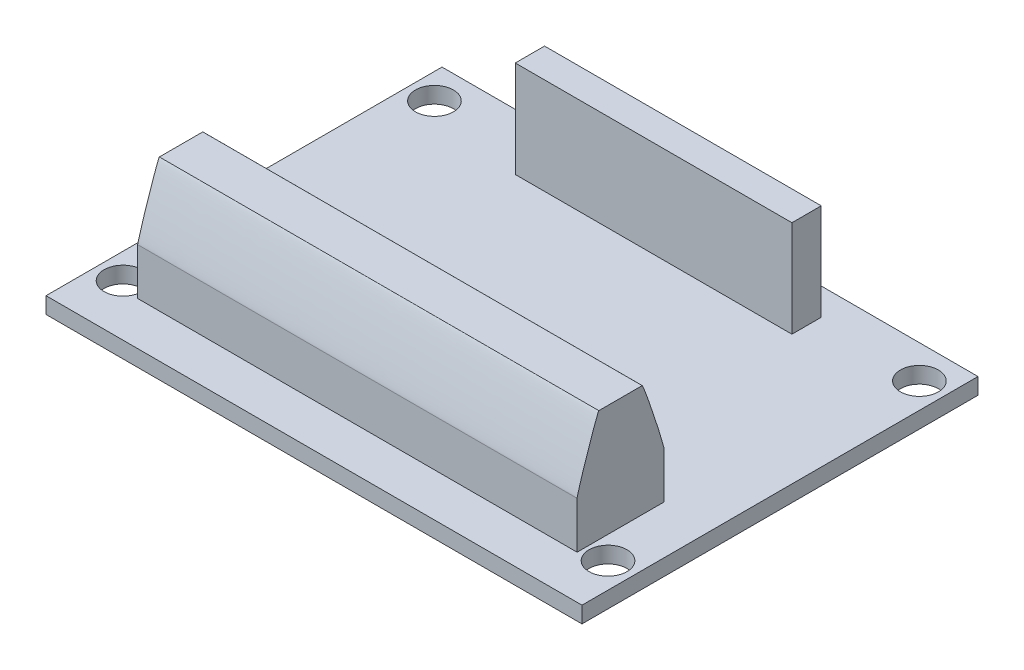
from build123d import *

# Parameters (mm, degrees)
SKETCH1_W           = 49.4
SKETCH1_H           = 36.5
SKETCH1_R           = 1.75
BOSS_EXTRUDE1_DEPTH = 1.5
SKETCH1_3_W         = 40.5
SKETCH1_3_H         = 8
BOSS_EXTRUDE2_DEPTH = 11.8
FILLET1_SIZE        = 6
FILLET1_SIZE_2      = 2
FILLET2_SIZE        = 6
FILLET2_SIZE_2      = 2
SKETCH1_4_W         = 25.5
SKETCH1_4_H         = 2.7
BOSS_EXTRUDE3_DEPTH = 10.4


with BuildPart() as part:
    # Sketch1 → Boss-Extrude1 (new body)
    with BuildSketch(Plane(origin=(0, 0, 0), x_dir=(1, 0, 0), z_dir=(0, 1, 0))):
        with Locations((-101.179682497, -14.992188262)):
            Rectangle(SKETCH1_W, SKETCH1_H)
        with Locations(Location((-123.529682497, 0.207811738, 0), (0, 0, 270))):
            Circle(SKETCH1_R, mode=Mode.SUBTRACT)
        with Locations(Location((-78.829682497, 0.207811738, 0), (0, 0, 270))):
            Circle(SKETCH1_R, mode=Mode.SUBTRACT)
        with Locations(Location((-123.529682497, -28.492188262, 0), (0, 0, 270))):
            Circle(SKETCH1_R, mode=Mode.SUBTRACT)
        with Locations(Location((-78.829682497, -28.492188262, 0), (0, 0, 270))):
            Circle(SKETCH1_R, mode=Mode.SUBTRACT)
    extrude(amount=BOSS_EXTRUDE1_DEPTH)

    # Sketch1<3> → Boss-Extrude2 (add)
    with BuildSketch(Plane(origin=(0, 0, 0), x_dir=(1, 0, 0), z_dir=(0, 1, 0))):
        with Locations((-101.179682497, -25.242188262)):
            Rectangle(SKETCH1_3_W, SKETCH1_3_H)
    extrude(amount=BOSS_EXTRUDE2_DEPTH)

    # Fillet1
    # a fillet whose section is not a circle: 6, 2 mm, written as the material it takes off along each edge
    with BuildSketch(Plane(origin=(-136.429682497, 11.8, 21.242188262), x_dir=(0, -1, 0), z_dir=(1, 0, 0))) as fillet1_piece_1:
        with BuildLine():
            Bezier((FILLET1_SIZE, 0), (0, 0), (0, -FILLET1_SIZE_2), weights=[1, 0.052631579, 1])
            Line((0, -FILLET1_SIZE_2), (0, 0))
            Line((0, 0), (FILLET1_SIZE, 0))
        make_face()
    extrude(amount=70.5, mode=Mode.SUBTRACT)

    # Fillet2
    # a fillet whose section is not a circle: 6, 2 mm, written as the material it takes off along each edge
    with BuildSketch(Plane(origin=(-65.929682497, 11.8, 29.242188262), x_dir=(0, -1, 0), z_dir=(-1, 0, 0))) as fillet2_piece_1:
        with BuildLine():
            Bezier((FILLET2_SIZE, 0), (0, 0), (0, -FILLET2_SIZE_2), weights=[1, 0.052631579, 1])
            Line((0, -FILLET2_SIZE_2), (0, 0))
            Line((0, 0), (FILLET2_SIZE, 0))
        make_face()
    extrude(amount=70.5, mode=Mode.SUBTRACT)

    # Sketch1<4> → Boss-Extrude3 (add)
    with BuildSketch(Plane(origin=(0, 0, 0), x_dir=(1, 0, 0), z_dir=(0, 1, 0))):
        with Locations((-101.179682497, -0.592188262)):
            Rectangle(SKETCH1_4_W, SKETCH1_4_H)
    extrude(amount=BOSS_EXTRUDE3_DEPTH)


solid = part.part
